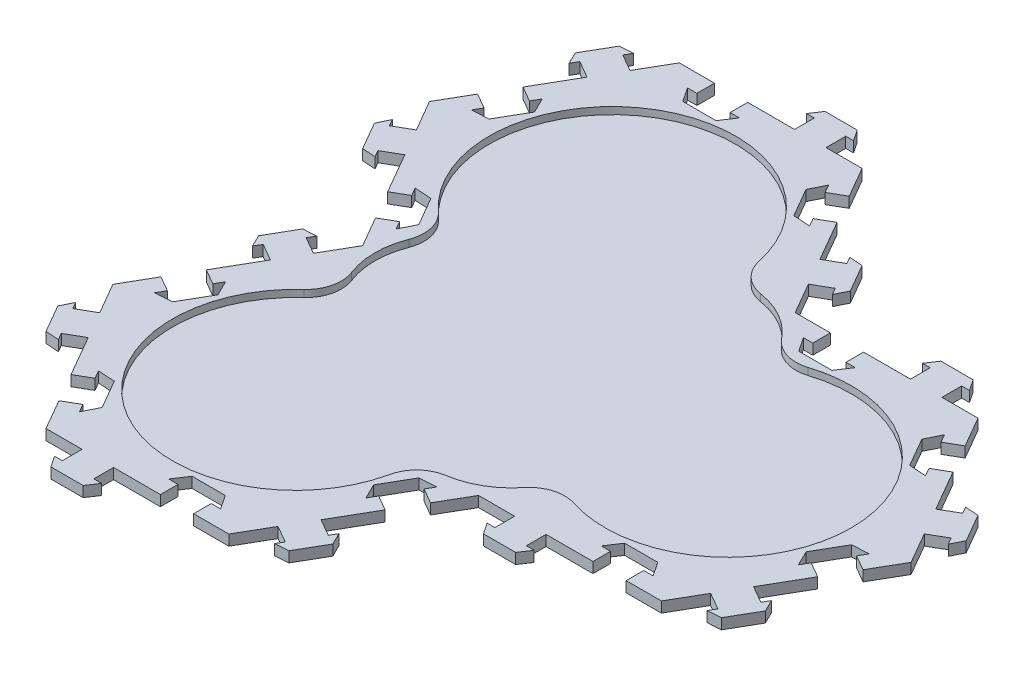
from build123d import *

# Parameters (mm, degrees)
BOSS_EXTRUDE4_DEPTH = 3
BOSS_EXTRUDE5_DEPTH = 1


with BuildPart() as part:
    # Sketch5 → Boss-Extrude4 (new body)
    with BuildSketch(Plane(origin=(0, 0, 0), x_dir=(1, 0, 0), z_dir=(0, 1, 0))):
        Polygon((93.923048454, 0), (103.923048454, 0), (109.048048454, 8.876760389), (113.897790715, 6.076760389), (112.790855681, 4.159492669), (116.56770856, 4.401193748), (121.154076451, 12.345015958), (119.474969287, 15.736717037), (118.368034252, 13.819449317), (113.518291991, 16.619449317), (120.183567031, 28.164044332), (115.853440012, 30.664044332), (114.521537971, 28.357122326), (112.389338397, 32.664044332), (117.109581934, 40.839745962), (121.90558559, 41.146667968), (120.573683549, 38.839745962), (124.903810568, 36.339745962), (129.903810568, 45), (124.778810568, 53.876760389), (129.628552829, 56.676760389), (130.735487863, 54.759492669), (132.414595028, 58.151193748), (127.828227137, 66.095015958), (124.051374257, 66.336717037), (125.158309292, 64.419449317), (120.308567031, 61.619449317), (113.643291991, 73.164044332), (109.313164972, 70.664044332), (110.645067013, 68.357122326), (105.849063357, 68.664044332), (101.12881982, 76.839745962), (103.261019394, 81.146667968), (104.592921435, 78.839745962), (108.923048454, 81.339745962), (103.923048454, 90), (93.673048454, 90), (93.673048454, 95.6), (95.886918523, 95.6), (93.789172808, 98.75), (84.616437026, 98.75), (82.518691311, 95.6), (84.73256138, 95.6), (84.73256138, 90), (71.402011301, 90), (71.402011301, 85), (74.065815383, 85), (71.402011301, 81), (61.961524227, 81), (59.297720145, 85), (61.961524227, 85), (61.961524227, 90), (51.961524227, 90), (46.836524227, 98.876760389), (51.686266488, 101.676760389), (52.793201523, 99.759492669), (54.472308687, 103.151193748), (49.885940796, 111.095015958), (46.109087917, 111.336717037), (47.216022951, 109.419449317), (42.36628069, 106.619449317), (35.701005651, 118.164044332), (31.370878632, 115.664044332), (32.702780673, 113.357122326), (27.906777016, 113.664044332), (23.186533479, 121.839745962), (25.318733054, 126.146667968), (26.650635095, 123.839745962), (30.980762114, 126.339745962), (25.980762114, 135), (15.730762114, 135), (15.730762114, 140.6), (17.944632182, 140.6), (15.846886468, 143.75), (6.674150685, 143.75), (4.576404971, 140.6), (6.790275039, 140.6), (6.790275039, 135), (-6.540275039, 135), (-6.540275039, 130), (-3.876470958, 130), (-6.540275039, 126), (-15.980762114, 126), (-18.644566195, 130), (-15.980762114, 130), (-15.980762114, 135), (-25.980762114, 135), (-31.105762114, 126.123239611), (-35.955504375, 128.923239611), (-34.84856934, 130.840507331), (-38.62542222, 130.598806252), (-43.211790111, 122.654984042), (-41.532682946, 119.263282963), (-40.425747912, 121.180550683), (-35.576005651, 118.380550683), (-42.24128069, 106.835955668), (-37.911153671, 104.335955668), (-36.57925163, 106.642877674), (-34.447052056, 102.335955668), (-39.167295593, 94.160254038), (-43.963299249, 93.853332032), (-42.631397208, 96.160254038), (-46.961524227, 98.660254038), (-51.961524227, 90), (-46.836524227, 81.123239611), (-51.686266488, 78.323239611), (-52.793201523, 80.240507331), (-54.472308687, 76.848806252), (-49.885940796, 68.904984042), (-46.109087917, 68.663282963), (-47.216022951, 70.580550683), (-42.36628069, 73.380550683), (-35.701005651, 61.835955668), (-31.370878632, 64.335955668), (-32.702780673, 66.642877674), (-27.906777016, 66.335955668), (-23.186533479, 58.160254038), (-25.318733054, 53.853332032), (-26.650635095, 56.160254038), (-30.980762114, 53.660254038), (-25.980762114, 45), (-31.105762114, 36.123239611), (-35.955504375, 38.923239611), (-34.84856934, 40.840507331), (-38.62542222, 40.598806252), (-43.211790111, 32.654984042), (-41.532682946, 29.263282963), (-40.425747912, 31.180550683), (-35.576005651, 28.380550683), (-42.24128069, 16.835955668), (-37.911153671, 14.335955668), (-36.57925163, 16.642877674), (-34.447052056, 12.335955668), (-39.167295593, 4.160254038), (-43.963299249, 3.853332032), (-42.631397208, 6.160254038), (-46.961524227, 8.660254038), (-51.961524227, 0), (-46.836524227, -8.876760389), (-51.686266488, -11.676760389), (-52.793201523, -9.759492669), (-54.472308687, -13.151193748), (-49.885940796, -21.095015958), (-46.109087917, -21.336717037), (-47.216022951, -19.419449317), (-42.36628069, -16.619449317), (-35.701005651, -28.164044332), (-31.370878632, -25.664044332), (-32.702780673, -23.357122326), (-27.906777016, -23.664044332), (-23.186533479, -31.839745962), (-25.318733054, -36.146667968), (-26.650635095, -33.839745962), (-30.980762114, -36.339745962), (-25.980762114, -45), (-15.730762114, -45), (-15.730762114, -50.6), (-17.944632182, -50.6), (-15.846886468, -53.75), (-6.674150685, -53.75), (-4.576404971, -50.6), (-6.790275039, -50.6), (-6.790275039, -45), (6.540275039, -45), (6.540275039, -40), (3.876470958, -40), (6.540275039, -36), (15.980762114, -36), (18.644566195, -40), (15.980762114, -40), (15.980762114, -45), (25.980762114, -45), (31.105762114, -36.123239611), (35.955504375, -38.923239611), (34.84856934, -40.840507331), (38.62542222, -40.598806252), (43.211790111, -32.654984042), (41.532682946, -29.263282963), (40.425747912, -31.180550683), (35.576005651, -28.380550683), (42.24128069, -16.835955668), (37.911153671, -14.335955668), (36.57925163, -16.642877674), (34.447052056, -12.335955668), (39.167295593, -4.160254038), (43.963299249, -3.853332032), (42.631397208, -6.160254038), (46.961524227, -8.660254038), (51.961524227, 0), (62.211524227, 0), (62.211524227, -5.6), (59.997654158, -5.6), (62.095399873, -8.75), (71.268135655, -8.75), (73.36588137, -5.6), (71.152011301, -5.6), (71.152011301, 0), (84.48256138, 0), (84.48256138, 5), (81.818757298, 5), (84.48256138, 9), (93.923048454, 9), (96.586852536, 5), (93.923048454, 5), align=None)
        with BuildLine():
            ThreePointArc((56.498481033, 81.6082397), (61.405999517, 78.302989323), (67.322603943, 78.349997688))
            ThreePointArc((67.322603943, 78.349997688), (112.942286341, 45), (67.322603943, 11.650002312))
            ThreePointArc((67.322603943, 11.650002312), (61.405999517, 11.697010677), (56.498481033, 8.3917603))
            ThreePointArc((56.498481033, 8.3917603), (50.22114317, 3.014428415), (42.425568222, 0.2667603))
            ThreePointArc((42.425568222, 0.2667603), (37.109378187, -2.330650188), (34.191786413, -7.478084108))
            ThreePointArc((34.191786413, -7.478084108), (-17.5, -30.310889132), (-23.572104015, 25.87191358))
            ThreePointArc((-23.572104015, 25.87191358), (-20.573091364, 30.972339135), (-20.981762914, 36.875))
            ThreePointArc((-20.981762914, 36.875), (-22.5, 45), (-20.981762914, 53.125))
            ThreePointArc((-20.981762914, 53.125), (-20.573091364, 59.027660865), (-23.572104015, 64.12808642))
            ThreePointArc((-23.572104015, 64.12808642), (-17.5, 120.310889132), (34.191786413, 97.478084108))
            ThreePointArc((34.191786413, 97.478084108), (37.109378187, 92.330650188), (42.425568222, 89.7332397))
            ThreePointArc((42.425568222, 89.7332397), (50.22114317, 86.985571585), (56.498481033, 81.6082397))
        make_face(mode=Mode.SUBTRACT)
    extrude(amount=BOSS_EXTRUDE4_DEPTH)

    # Sketch5<3> → Boss-Extrude5 (add)
    with BuildSketch(Plane(origin=(0, 0, 0), x_dir=(1, 0, 0), z_dir=(0, 1, 0))):
        with BuildLine():
            ThreePointArc((34.191786413, -7.478084108), (37.109378187, -2.330650188), (42.425568222, 0.2667603))
            ThreePointArc((42.425568222, 0.2667603), (50.22114317, 3.014428415), (56.498481033, 8.3917603))
            ThreePointArc((56.498481033, 8.3917603), (61.405999517, 11.697010677), (67.322603943, 11.650002312))
            ThreePointArc((67.322603943, 11.650002312), (112.942286341, 45), (67.322603943, 78.349997688))
            ThreePointArc((67.322603943, 78.349997688), (61.405999517, 78.302989323), (56.498481033, 81.6082397))
            ThreePointArc((56.498481033, 81.6082397), (50.22114317, 86.985571585), (42.425568222, 89.7332397))
            ThreePointArc((42.425568222, 89.7332397), (37.109378187, 92.330650188), (34.191786413, 97.478084108))
            ThreePointArc((34.191786413, 97.478084108), (-17.5, 120.310889132), (-23.572104015, 64.12808642))
            ThreePointArc((-23.572104015, 64.12808642), (-20.573091364, 59.027660865), (-20.981762914, 53.125))
            ThreePointArc((-20.981762914, 53.125), (-22.5, 45), (-20.981762914, 36.875))
            ThreePointArc((-20.981762914, 36.875), (-20.573091364, 30.972339135), (-23.572104015, 25.87191358))
            ThreePointArc((-23.572104015, 25.87191358), (-17.5, -30.310889132), (34.191786413, -7.478084108))
        make_face()
    extrude(amount=BOSS_EXTRUDE5_DEPTH)


solid = part.part
